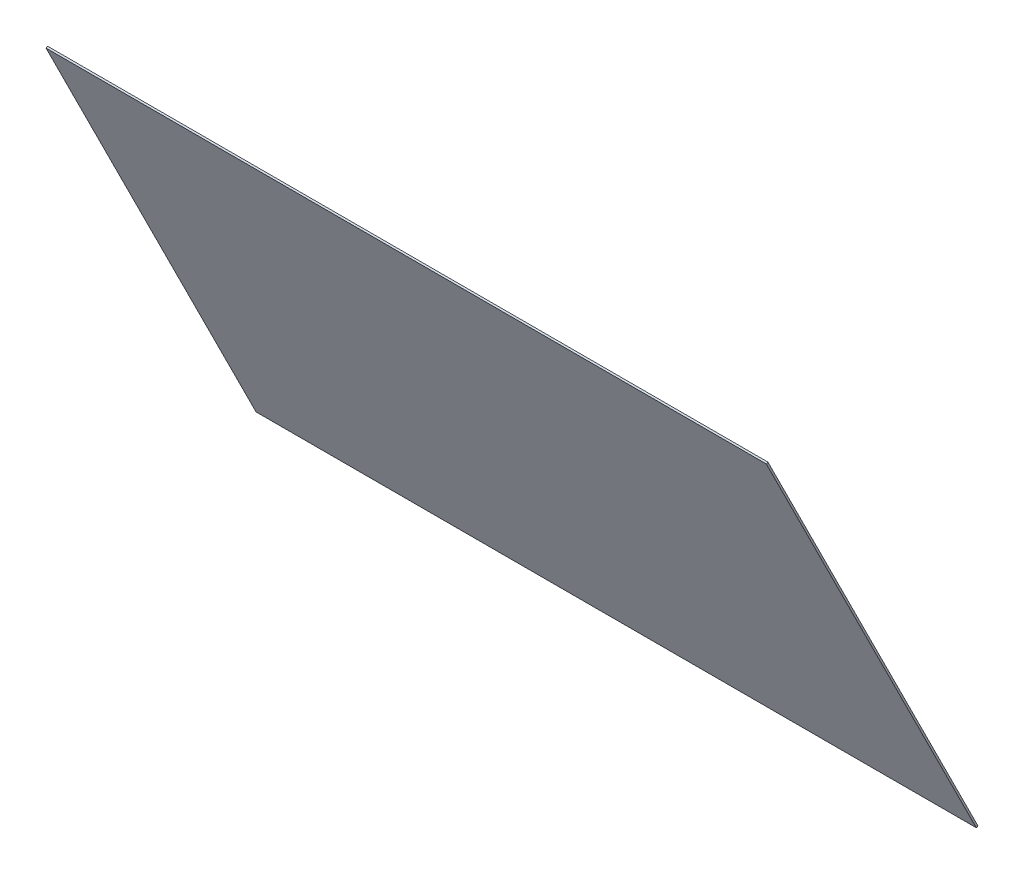
from build123d import *

# Parameters (mm, degrees)
BASE_FLANGE1_DEPTH = 600


# Sheet-metal steps are written as plain solids
with BuildPart() as part:
    # Sketch1 → Base-Flange1 (new, symmetric)
    with BuildSketch(Plane(origin=(0, 0, 0), x_dir=(0, 0, -1), z_dir=(1, 0, 0))):
        Polygon((0, 0), (350, -700), (347.316718427, -701.341640786), (-2.683281573, -1.341640786), align=None)
    extrude(amount=BASE_FLANGE1_DEPTH, both=True)


solid = part.part
